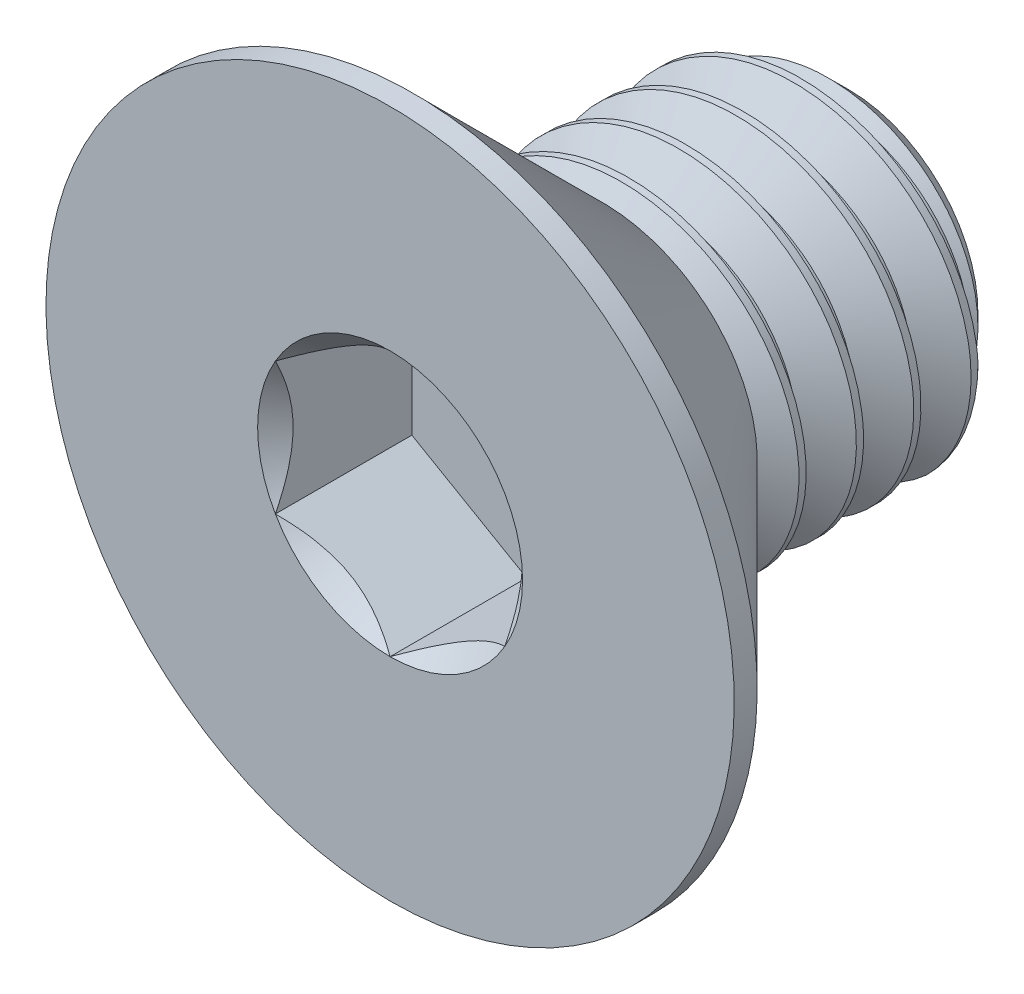
from build123d import *
from build123d.topology import SkipClean

# Parameters (mm, degrees)
SKETCH1_W          = 4
SKETCH1_H          = 1.5
CHAMFER1_SIZE      = 0.375
CUT_SWEEP1_PITCH   = 0.5
CUT_EXTRUDE2_DEPTH = 1.19


with BuildPart() as part:
    # Sketch1 → Revolve1 (revolve)
    with BuildSketch(Plane(origin=(0, 0, 0), x_dir=(0, 0, -1), z_dir=(1, 0, 0))):
        with Locations((2, 0.75)):
            Rectangle(SKETCH1_W, SKETCH1_H)
    revolve(axis=Axis((0, 0, -4), (0, 0, 1)))

    # Chamfer1
    chamfer1_edges = [part.edges().sort_by_distance(p)[0] for p in [
        (0, -1.5, -4),
    ]]
    chamfer(chamfer1_edges, length=CHAMFER1_SIZE)

    # Cut-Sweep1: arcs per turn and ends read off the stored shape
    # Cut-Sweep1: the profile of Sketch2 profile screwed along a right-hand helix through 9 turns, 6 arcs to a turn; built about Z, then put on its axis
    cut_sweep1_z = Axis((0, 0, 0), (0, 0, 1))
    cut_sweep1_corners = [(1.5006, 0, 0.00034641), (1.5006, 0, -0.43784641), (1.175240474, 0, -0.25), (1.175240474, 0, -0.1875)]
    with BuildLine(mode=Mode.PRIVATE) as cut_sweep1_profile:
        Line(cut_sweep1_corners[0], cut_sweep1_corners[1])
        Line(cut_sweep1_corners[1], cut_sweep1_corners[2])
        Line(cut_sweep1_corners[2], cut_sweep1_corners[3])
        Line(cut_sweep1_corners[3], cut_sweep1_corners[0])
    cut_sweep1_cap = Face(cut_sweep1_profile.wire())
    cut_sweep1_turn_angles = [0, 30, 60, 90, 120, 150, 180, 210, 240, 270, 300, 330, 360]
    cut_sweep1_turn_weights = [1, 0.8660254037844387, 1, 0.8660254037844387, 1, 0.8660254037844387, 1, 0.8660254037844387, 1, 0.8660254037844387, 1, 0.8660254037844387, 1]
    cut_sweep1_turn_rails = [Edge.make_bspline([Vector(p[0], p[1], 0).rotate(cut_sweep1_z, cut_sweep1_turn_angles[k]) / cut_sweep1_turn_weights[k] + Vector(0, 0, p[2] + CUT_SWEEP1_PITCH * cut_sweep1_turn_angles[k] / 360) for k in range(13)], [0, 0, 0, 1, 1, 2, 2, 3, 3, 4, 4, 5, 5, 6, 6, 6], 2, cut_sweep1_turn_weights) for p in cut_sweep1_corners]
    cut_sweep1_turn_sides = [Face.make_surface_from_curves(cut_sweep1_turn_rails[p[0]], cut_sweep1_turn_rails[p[1]]) for p in [(0, 1), (1, 2), (2, 3), (3, 0)]]
    cut_sweep1 = Plane(origin=(0, 0, -4), x_dir=(0, 1, 0), z_dir=(0, 0, 1)) * Solid(Shell([*[p.moved(Location((0, 0, CUT_SWEEP1_PITCH * i))) for i in range(9) for p in cut_sweep1_turn_sides], cut_sweep1_cap, cut_sweep1_cap.rotate(cut_sweep1_z, 3240).moved(Location((0, 0, CUT_SWEEP1_PITCH * 3240 / 360)))]))
    add(cut_sweep1, mode=Mode.SUBTRACT)

    # Sketch7 → Revolve2 (revolve)
    with BuildSketch(Plane(origin=(0, 0, 0), x_dir=(0, 0, -1), z_dir=(1, 0, 0)), mode=Mode.PRIVATE) as revolve2_sk:
        Polygon((0, 3), (0.2, 3), (1.7, 1.5), (1.7, 0), (0, 0), align=None)
    revolve(revolve2_sk.sketch.rotate(Axis((0, 0, 0), (0, 0, -1)), 180), axis=Axis((0, 0, 0), (0, 0, -1)))

    # Boss-Extrude1 cone 1 section (through the dimple's axis) → Boss-Extrude1 (revolve)
    with SkipClean():  # the faces are left unmerged after this step: merging them gives an invalid solid
        with BuildSketch(Plane(origin=(0, 0, -1.7), x_dir=(0, -1, 0), z_dir=(1, 0, 0))):
            Polygon((0, 0), (1.5, 0), (0, 1.5), align=None)
        revolve(axis=Axis((0, 0, -1.7), (0, 0, -1)))

    # Sketch5 → Cut-Extrude2 (cut)
    with SkipClean():  # the faces are left unmerged after this step: merging them gives an invalid solid
        with BuildSketch(Plane.XY):
            Polygon((1, -0.577350269), (1, 0.577350269), (0, 1.154700538), (-1, 0.577350269), (-1, -0.577350269), (0, -1.154700538), align=None)
        extrude(amount=-CUT_EXTRUDE2_DEPTH, mode=Mode.SUBTRACT)

    # Cut-Extrude3 cone 1 section (through the dimple's axis) → Cut-Extrude3 (revolve, cut)
    with SkipClean():  # the faces are left unmerged after this step: merging them gives an invalid solid
        with BuildSketch(Plane(origin=(0, 0, 0), x_dir=(0, -1, 0), z_dir=(1, 0, 0))):
            Polygon((0, 0), (1.154700538, 0), (0, 1.154700538), align=None)
        revolve(axis=Axis((0, 0, 0), (0, 0, -1)), mode=Mode.SUBTRACT)


solid = part.part
